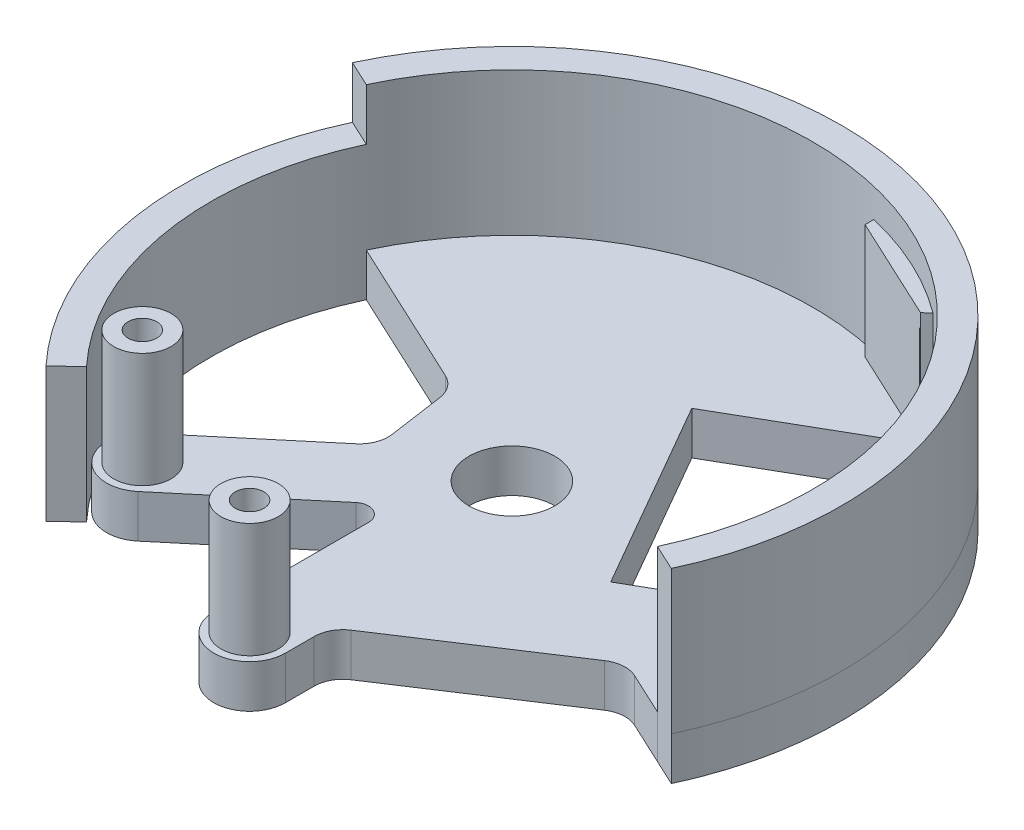
from build123d import *
from build123d.topology import SkipClean

# Parameters (mm, degrees)
SKETCH_1_W          = 10
SKETCH_1_H          = 2
REVOLVE_1_ANGLE     = 180
SKETCH_2_R          = 3
EXTRUDE_1_DEPTH     = 3
SKETCH_3_R          = 2
EXTRUDE_2_DEPTH     = 8
SKETCH_4_R          = 2
EXTRUDE_3_DEPTH     = 8
HOLE_WIZARD_1_D     = 2
HOLE_WIZARD_1_DEPTH = 8
RIB_START           = 3
RIB_1_DEPTH         = 8
SKETCH_8_R          = 1
CUT_EXTRUDE_1_DEPTH = 10
CUT_EXTRUDE_START   = -11
SKETCH_9_R          = 1
CUT_EXTRUDE_2_DEPTH = 11
SKETCH_10_W         = 2
SKETCH_10_H         = 9.392270145
SKETCH_11_W         = 2
SKETCH_11_H         = 9.392270145
CUT_REVOLVE_2_ANGLE = 112
CUT_EXTRUDE_4_DEPTH = 10


# Read off the part's stored shape, not the designer's step: 筋1
with BuildPart() as part:
    # 草图1 → 旋转1 (revolve)
    with BuildSketch(Plane(origin=(0, 0, 0), x_dir=(0, -1, 0), z_dir=(-0.422618261740697, 0, 0.9063077870366512))):
        with Locations((-8, 22)):
            Rectangle(SKETCH_1_W, SKETCH_1_H)
    revolve(axis=Axis((0, 13, 0), (0, 1, 0)), revolution_arc=REVOLVE_1_ANGLE)

    # 草图2 → 凸台-拉伸1 (add)
    with BuildSketch(Plane.XZ.offset(-3)):
        with BuildLine():
            Line((-7.687738047, 3.187259937), (-15.625582333, 9.847902149))
            ThreePointArc((-15.625582333, 9.847902149), (-15.933724417, 13.369982281), (-12.411644285, 13.678124365))
            Line((-12.411644285, 13.678124365), (-4.14278761, 6.739729779))
            ThreePointArc((-4.14278761, 6.739729779), (-3.077381738, 6.599466435), (-2.5, 7.505774222))
            Line((-2.5, 7.505774222), (-2.5, 18.3))
            ThreePointArc((-2.5, 18.3), (0, 20.8), (2.5, 18.3))
            Line((2.5, 18.3), (2.5, 16.292228073))
            ThreePointArc((2.5, 16.292228073), (2.740367594, 15.341599967), (3.403693795, 14.619472052))
            Line((3.403693795, 14.619472052), (10.364457725, 10.057462653))
            Line((10.364457725, 10.057462653), (14.091579804, 7.614747152))
            ThreePointArc((14.091579804, 7.614747152), (15.044154935, 7.292674514), (16.033062771, 7.474859732))
            Line((16.033062771, 7.474859732), (20.071872558, 9.358025555))
            Line((20.071872558, 9.358025555), (20.845720003, 9.718845484))
            ThreePointArc((20.845720003, 9.718845484), (9.719853203, -20.84608682), (-20.845079102, -9.72022002))
            Line((-20.845079102, -9.72022002), (-8.687048035, -4.051325027))
            ThreePointArc((-8.687048035, -4.051325027), (-7.926279341, -3.430713127), (-7.552514649, -2.522843041))
            Line((-7.552514649, -2.522843041), (-6.993603119, 1.371009596))
            ThreePointArc((-6.993603119, 1.371009596), (-7.105101968, 2.369164428), (-7.687738047, 3.187259937))
        make_face()
        with Locations(Location((0.000320451, -0.000687268, 0), (0, 0, 90))):
            Circle(SKETCH_2_R, mode=Mode.SUBTRACT)
    extrude(amount=EXTRUDE_1_DEPTH)

    # 草图3 → 凸台-拉伸2 (add)
    with BuildSketch(Plane(origin=(0, 3, 0), x_dir=(-1, 0, 0), z_dir=(0, 1, 0))):
        with Locations(Location((14.018613309, 11.763013257, 0), (0, 0, 90))):
            Circle(SKETCH_3_R)
    extrude(amount=EXTRUDE_2_DEPTH)

    # 草图4 → 凸台-拉伸3 (add)
    with BuildSketch(Plane(origin=(0, 3, 0), x_dir=(-1, 0, 0), z_dir=(0, 1, 0))):
        with Locations(Location((0, 18.3, 0), (0, 0, 90))):
            Circle(SKETCH_4_R)
    extrude(amount=EXTRUDE_3_DEPTH)

    # 孔1
    with Locations(Plane(origin=(0, 11, 0), x_dir=(1, 0, 0), z_dir=(0, 1, 0))):
        with Locations((0, -18.3), (-14.018613309, -11.763013257)):
            Hole(HOLE_WIZARD_1_D / 2, depth=HOLE_WIZARD_1_DEPTH)

    # 筋1 outline → 筋1 (add)
    with BuildSketch(Plane(origin=(0, 0, 0), x_dir=(1, 0, 0), z_dir=(0, 1, 0)).offset(RIB_START)):
        with BuildLine():
            ThreePointArc((12.553349452, 16.834886918), (8.874983497, 19.032463528), (4.827134087, 20.437680312))
            Line((4.827134087, 20.437680312), (4.827134087, 19.816628788))
            Line((4.827134087, 19.816628788), (12.077596383, 16.435682694))
            Line((12.077596383, 16.435682694), (12.553349452, 16.834886918))
        make_face()
    extrude(amount=RIB_1_DEPTH)

    # 草图8 → 切除-拉伸1 (cut)
    with BuildSketch(Plane.XZ):
        with Locations(Location((-14.018613309, 11.763013257, 0), (0, 0, 90))):
            Circle(SKETCH_8_R)
    extrude(amount=-CUT_EXTRUDE_1_DEPTH, mode=Mode.SUBTRACT)

    # 草图9 → 切除-拉伸2 (cut)
    with BuildSketch(Plane(origin=(0, 11, 0), x_dir=(1, 0, 0), z_dir=(0, 1, 0)).offset(CUT_EXTRUDE_START)):
        with Locations(Location((0, -18.3, 0), (0, 0, 270))):
            Circle(SKETCH_9_R)
    extrude(amount=CUT_EXTRUDE_2_DEPTH, mode=Mode.SUBTRACT)

    # 草图10 → 旋转15 (revolve)
    with SkipClean():  # the faces are left unmerged after this step: merging them gives an invalid solid
        with BuildSketch(Plane(origin=(0, 0, 0), x_dir=(0.9063077870366516, 0, 0.4226182617406962), z_dir=(-0.4226182617406962, 0, 0.9063077870366516)), mode=Mode.PRIVATE) as revolve_15_sk:
            with Locations((-22, 4.696135073)):
                Rectangle(SKETCH_10_W, SKETCH_10_H)
        revolve(revolve_15_sk.sketch.rotate(Axis((0, 0, 0), (0, 1, 0)), 281.710962798), axis=Axis((0, 0, 0), (0, 1, 0)))

    # 草图11 → 切除-旋转2 (revolve, cut)
    with BuildSketch(Plane(origin=(0, 0, 0), x_dir=(0.9063077870366513, 0, 0.42261826174069694), z_dir=(-0.42261826174069694, 0, 0.9063077870366513))):
        with Locations((22, 4.696135073)):
            Rectangle(SKETCH_11_W, SKETCH_11_H)
    revolve(axis=Axis((0, 0, 0), (0, -1, 0)), revolution_arc=CUT_REVOLVE_2_ANGLE, mode=Mode.SUBTRACT)

    # 草图12 → 切除-拉伸4 (cut)
    with BuildSketch(Plane.XZ):
        Polygon((9.548814336, 2.649444135), (1.884926874, -10.672654147), (11.982316999, -16.481443418), (19.646204461, -3.159345136), align=None)
    extrude(amount=-CUT_EXTRUDE_4_DEPTH, mode=Mode.SUBTRACT)


solid = part.part
